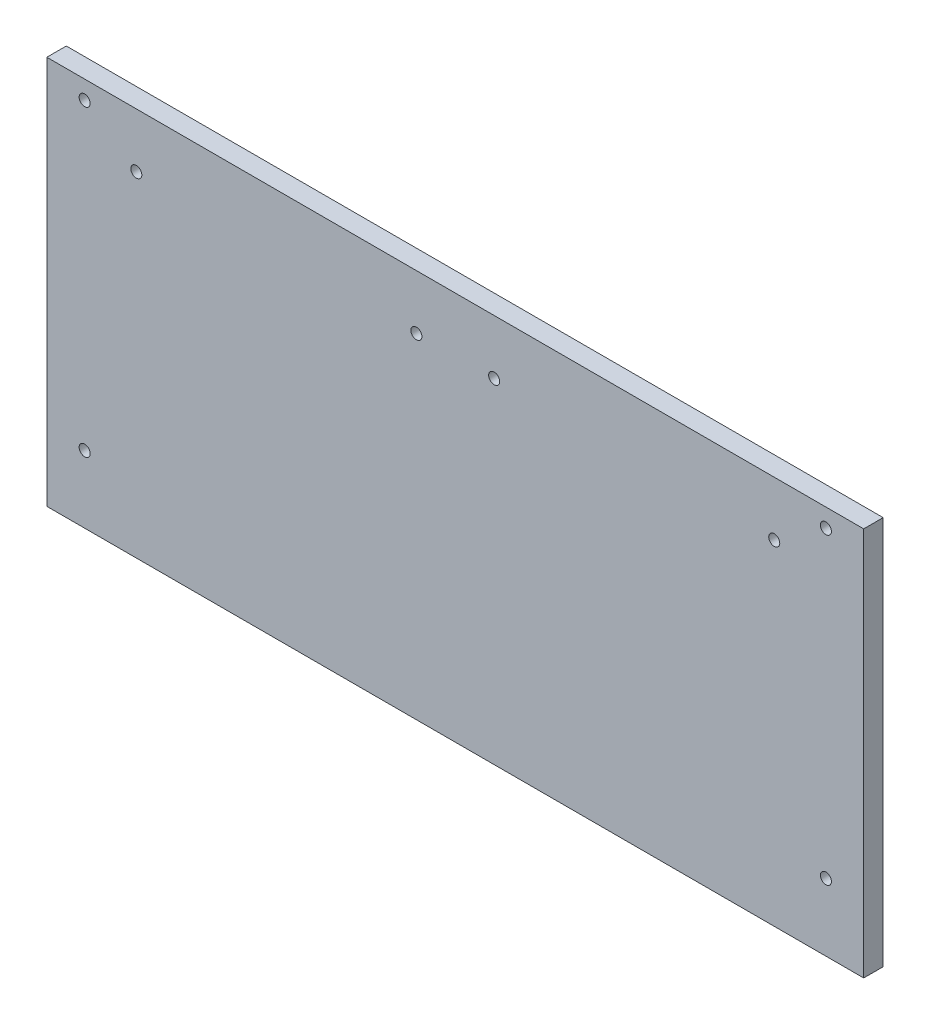
from build123d import *

# Parameters (mm, degrees)
SKETCH1_W            = 266.7
SKETCH1_H            = 127
BOSS_EXTRUDE1_DEPTH  = 6.35
M3_CLEARANCE_HOLE1_D = 3.6
M3_CLEARANCE_HOLE2_D = 3.6


with BuildPart() as part:
    # Sketch1 → Boss-Extrude1 (new body)
    with BuildSketch(Plane.XY):
        with Locations((133.35, 63.5)):
            Rectangle(SKETCH1_W, SKETCH1_H)
    extrude(amount=BOSS_EXTRUDE1_DEPTH)

    # M3 Clearance Hole1 (through all)
    with Locations(Plane.XY.offset(6.35)):
        with Locations((12.3444, 121.0056), (12.3444, 21.9964), (254.3556, 21.9964), (254.3556, 121.0056)):
            Hole(M3_CLEARANCE_HOLE1_D / 2)

    # M3 Clearance Hole2 (through all)
    with Locations(Plane.XY.offset(6.35)):
        with Locations((29.21, 109.22), (120.65, 109.22), (146.05, 109.22), (237.49, 109.22)):
            Hole(M3_CLEARANCE_HOLE2_D / 2)


solid = part.part
